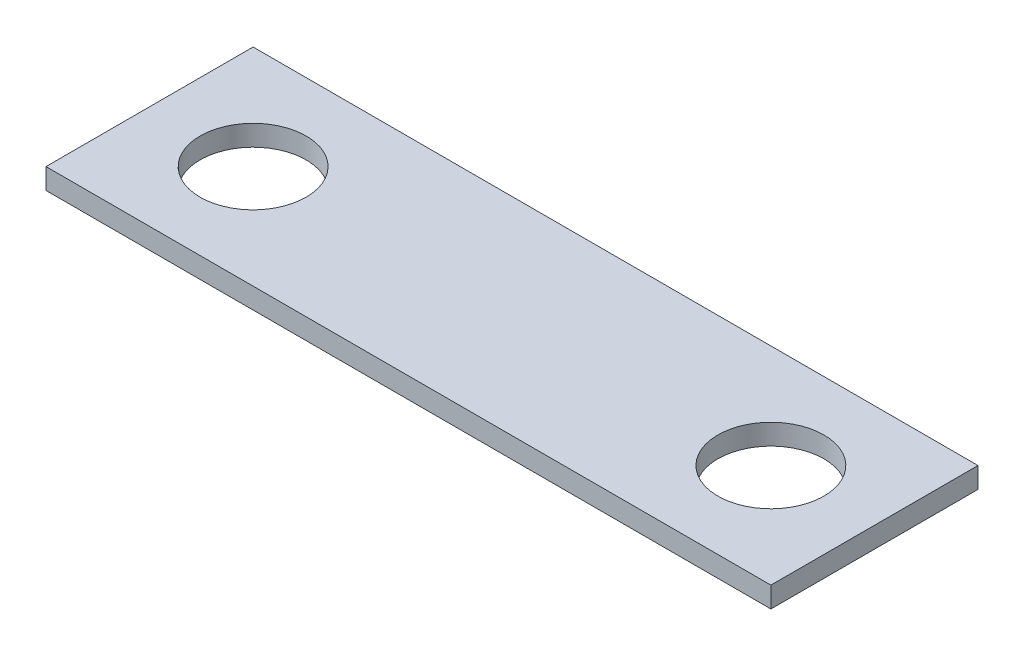
from build123d import *

# Parameters (mm, degrees)
SKETCH1_W           = 44.45
SKETCH1_H           = 12.7
SKETCH1_R           = 3.2512
BOSS_EXTRUDE1_DEPTH = 1.27


with BuildPart() as part:
    # Sketch1 → Boss-Extrude1 (new body)
    with BuildSketch(Plane(origin=(0, 0, 0), x_dir=(1, 0, 0), z_dir=(0, 1, 0))):
        with Locations((22.225, 6.35)):
            Rectangle(SKETCH1_W, SKETCH1_H)
        with Locations((6.35, 6.35)):
            Circle(SKETCH1_R, mode=Mode.SUBTRACT)
        with Locations((38.1, 6.35)):
            Circle(SKETCH1_R, mode=Mode.SUBTRACT)
    extrude(amount=BOSS_EXTRUDE1_DEPTH)


solid = part.part
